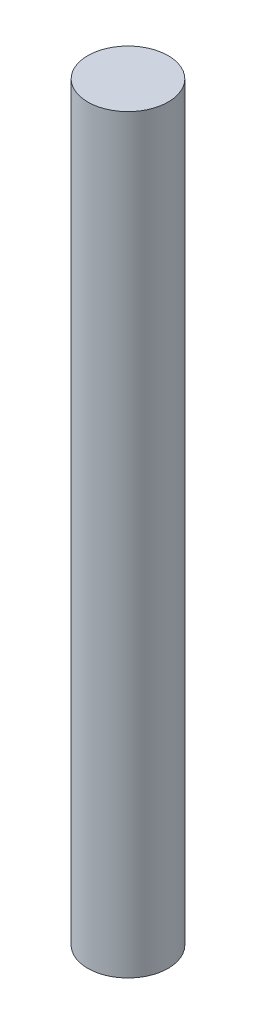
from build123d import *

# Parameters (mm, degrees)
SKETCH1_R           = 1.5
BOSS_EXTRUDE1_DEPTH = 28


with BuildPart() as part:
    # Sketch1 → Boss-Extrude1 (new body)
    with BuildSketch(Plane(origin=(0, 0, 0), x_dir=(1, 0, 0), z_dir=(0, 1, 0))):
        Circle(SKETCH1_R)
    extrude(amount=BOSS_EXTRUDE1_DEPTH)


solid = part.part
